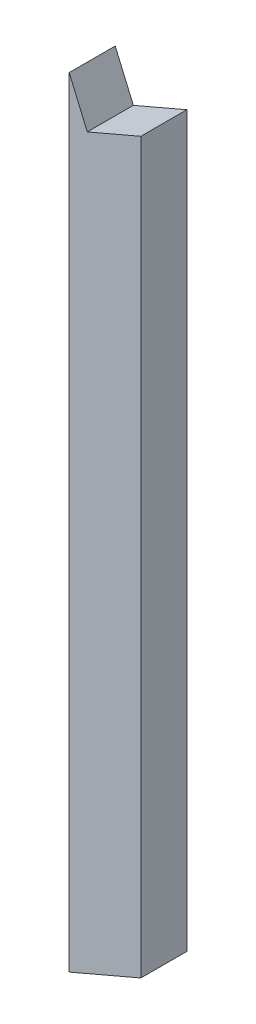
from build123d import *

# Parameters (mm, degrees)
SKETCH1_W          = 70
SKETCH1_H          = 45
SHAPE_DEPTH        = 1000
CUT_EXTRUDE1_REACH = 1003.624


with BuildPart() as part:
    # Sketch1 → Shape (new body)
    with BuildSketch(Plane(origin=(0, 0, 0), x_dir=(1, 0, 0), z_dir=(0, 1, 0))):
        Rectangle(SKETCH1_W, SKETCH1_H)
    extrude(amount=SHAPE_DEPTH)

    # Sketch4 → Cut-Extrude1 (cut, up to next)
    with BuildSketch(Plane.XY.offset(22.5), mode=Mode.PRIVATE) as cut_extrude1_sk1:
        Polygon((35, 0), (35, 30), (-35, 0), align=None)
    cut_extrude1_tool1 = extrude(cut_extrude1_sk1.sketch, amount=-CUT_EXTRUDE1_REACH, mode=Mode.PRIVATE) & part.part
    # Sketch4 → Cut-Extrude1 (cut, up to next)
    with BuildSketch(Plane.XY.offset(22.5), mode=Mode.PRIVATE) as cut_extrude1_sk2:
        Polygon((-17.273631564, 720.215784236), (35, 742.618769192), (35, 1000), (-35, 1000), (-35, 761.577310586), align=None)
    cut_extrude1_tool2 = extrude(cut_extrude1_sk2.sketch, amount=-CUT_EXTRUDE1_REACH, mode=Mode.PRIVATE) & part.part
    add(cut_extrude1_tool1.solids().sort_by_distance((11.666667, 10, 22.5))[0], mode=Mode.SUBTRACT)
    add(cut_extrude1_tool2.solids().sort_by_distance((0.020046, 866.750472, 22.5))[0], mode=Mode.SUBTRACT)


solid = part.part
